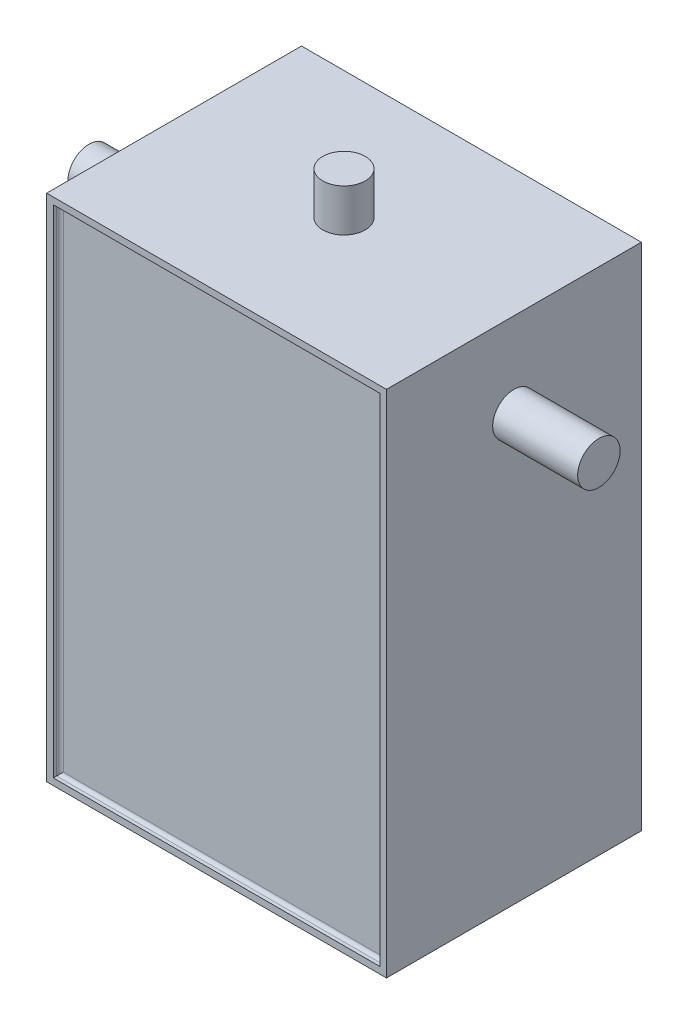
from build123d import *

# Parameters (mm, degrees)
SKETCH1_W            = 101.6
SKETCH1_H            = 152.4
BOSS_EXTRUDE1_DEPTH  = 76.2
SKETCH2_R            = 6.35
BOSS_EXTRUDE2_DEPTH  = 25.4
LPATTERN1_COUNT      = 2
LPATTERN1_PITCH      = 127
SKETCH3_R            = 12.7
BOSS_EXTRUDE3_DEPTH  = 12.7
SKETCH4_W            = 97.6
SKETCH4_H            = 148.4
CUT_EXTRUDE1_DEPTH   = 2
FILLET1_R            = 1
FILLET1_OF_MIRROR1_R = 1
SKETCH5_R            = 6.35
BOSS_EXTRUDE4_DEPTH  = 12.7


with BuildPart() as part:
    # Sketch1 → Boss-Extrude1 (new body)
    with BuildSketch(Plane.XY):
        with Locations((50.8, 76.2)):
            Rectangle(SKETCH1_W, SKETCH1_H)
    extrude(amount=-BOSS_EXTRUDE1_DEPTH)

    # Sketch2 → Boss-Extrude2 (add)
    with BuildSketch(Plane(origin=(101.6, 0, 0), x_dir=(0, 0, -1), z_dir=(1, 0, 0))):
        with Locations((38.1, 127)):
            Circle(SKETCH2_R)
    boss_extrude2 = extrude(amount=BOSS_EXTRUDE2_DEPTH)

    # LPattern1: Boss-Extrude2 ×2
    with Locations(*[(-i * LPATTERN1_PITCH, 0, 0) for i in range(1, LPATTERN1_COUNT)]):
        add(boss_extrude2)

    # Sketch3 → Boss-Extrude3 (add)
    with BuildSketch(Plane.XZ):
        with Locations((50.8, -38.1)):
            Circle(SKETCH3_R)
    extrude(amount=BOSS_EXTRUDE3_DEPTH)

    # Sketch4 → Cut-Extrude1 (cut)
    with BuildSketch(Plane.XY):
        with Locations((50.8, 76.2)):
            Rectangle(SKETCH4_W, SKETCH4_H)
    cut_extrude1 = extrude(amount=-CUT_EXTRUDE1_DEPTH, mode=Mode.SUBTRACT)

    # Fillet1
    fillet1_edges = [part.edges().sort_by_distance(p)[0] for p in [
        (50.8, 2, -2),
        (2, 76.2, -2),
        (99.6, 76.2, -2),
        (50.8, 150.4, -2),
    ]]
    fillet(fillet1_edges, radius=FILLET1_R)

    # Mirror1: Cut-Extrude1 across plane
    add(cut_extrude1.mirror(Plane.XY.offset(-38.1)), mode=Mode.SUBTRACT)

    # Fillet1 of Mirror1
    fillet1_of_mirror1_edges = [part.edges().sort_by_distance(p)[0] for p in [
        (50.8, 2, -74.2),
        (2, 76.2, -74.2),
        (99.6, 76.2, -74.2),
        (50.8, 150.4, -74.2),
    ]]
    fillet(fillet1_of_mirror1_edges, radius=FILLET1_OF_MIRROR1_R)

    # Sketch5 → Boss-Extrude4 (add)
    with BuildSketch(Plane(origin=(0, 152.4, 0), x_dir=(1, 0, 0), z_dir=(0, 1, 0))):
        with Locations((50.8, 38.1)):
            Circle(SKETCH5_R)
    extrude(amount=BOSS_EXTRUDE4_DEPTH)


solid = part.part
